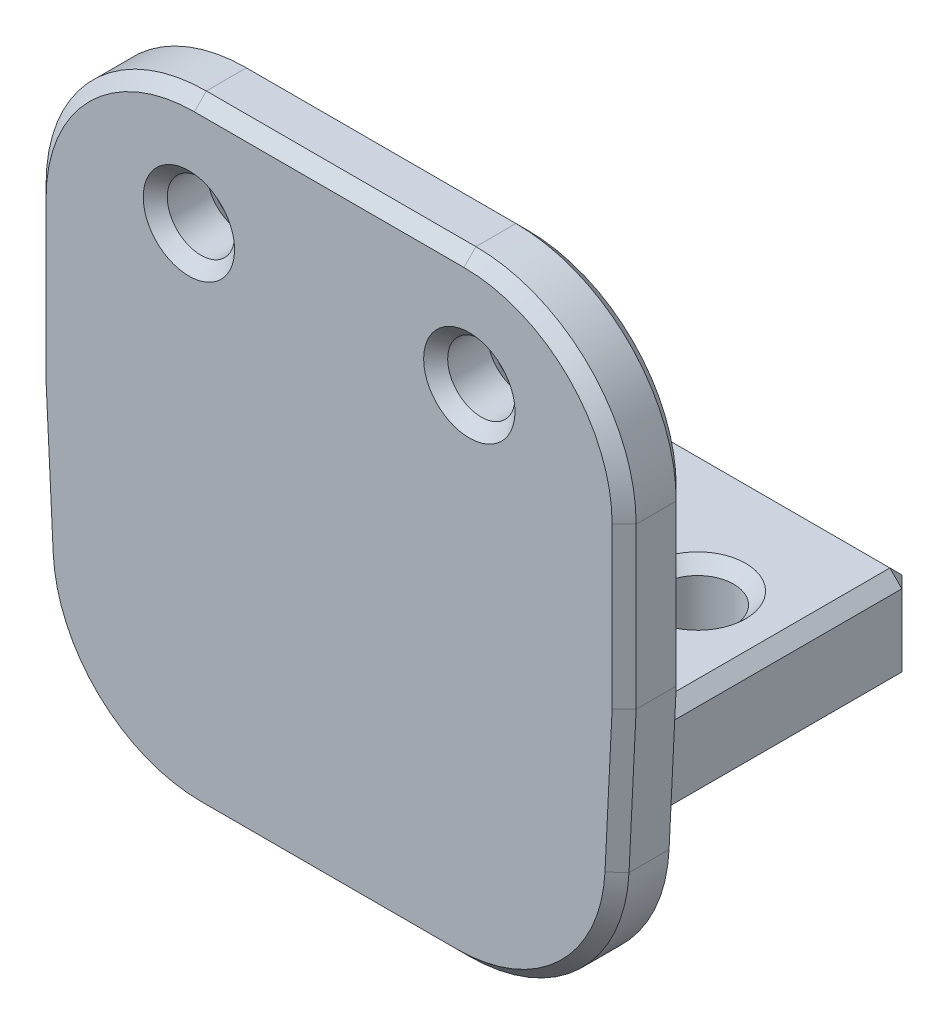
from build123d import *

# Parameters (mm, degrees)
SKETCH1_W           = 25
SKETCH1_H           = 25
BOSS_EXTRUDE1_DEPTH = 6
BOSS_EXTRUDE3_DEPTH = 4
SKETCH2_R           = 2.25
CUT_EXTRUDE1_DEPTH  = 6
SKETCH9_W           = 25
SKETCH9_H           = 6
CUT_EXTRUDE2_DEPTH  = 1
SKETCH11_W          = 36.82832664
SKETCH11_H          = 4
BOSS_EXTRUDE4_DEPTH = 20
SKETCH13_R          = 2.1
CUT_EXTRUDE3_DEPTH  = 50.410927182
FILLET2_R           = 10
CHAMFER1_SIZE       = 0.75
CHAMFER2_SIZE       = 0.75
CHAMFER3_SIZE       = 0.75


with BuildPart() as part:
    # Sketch1 → Boss-Extrude1 (new body)
    with BuildSketch(Plane(origin=(0, 0, 0), x_dir=(1, 0, 0), z_dir=(0, 1, 0))):
        with Locations((12.5, 12.5)):
            Rectangle(SKETCH1_W, SKETCH1_H)
    extrude(amount=BOSS_EXTRUDE1_DEPTH)

    # Sketch5 → Boss-Extrude3 (add)
    with BuildSketch(Plane.XY):
        Polygon((-5.91332664, 12.95), (30.915, 12.95), (30, -5.62), (-5, -5.62), align=None)
    extrude(amount=-BOSS_EXTRUDE3_DEPTH)

    # Sketch2 → Cut-Extrude1 (cut)
    with BuildSketch(Plane.XZ):
        with Locations(Location((5.5, -16, 0), (0, 0, 270))):
            Circle(SKETCH2_R)
        with Locations(Location((19.5, -16, 0), (0, 0, 90))):
            Circle(SKETCH2_R)
    extrude(amount=-CUT_EXTRUDE1_DEPTH, mode=Mode.SUBTRACT)

    # Sketch9 → Cut-Extrude2 (cut)
    with BuildSketch(Plane(origin=(0, 0, -25), x_dir=(-1, 0, 0), z_dir=(0, 0, -1))):
        with Locations((-12.5, 3)):
            Rectangle(SKETCH9_W, SKETCH9_H)
    extrude(amount=-CUT_EXTRUDE2_DEPTH, mode=Mode.SUBTRACT)

    # Sketch11 → Boss-Extrude4 (add)
    with BuildSketch(Plane(origin=(0, 12.95, 0), x_dir=(1, 0, 0), z_dir=(0, 1, 0))):
        with Locations((12.50083668, 2)):
            Rectangle(SKETCH11_W, SKETCH11_H)
    extrude(amount=BOSS_EXTRUDE4_DEPTH)

    # Sketch13 → Cut-Extrude3 (cut, through all)
    with BuildSketch(Plane(origin=(0, 0, -4), x_dir=(-1, 0, 0), z_dir=(0, 0, -1))):
        with Locations((-21.25, 26)):
            Circle(SKETCH13_R)
        with Locations((-3.75, 26)):
            Circle(SKETCH13_R)
    extrude(amount=-CUT_EXTRUDE3_DEPTH, mode=Mode.SUBTRACT)

    # Fillet2
    fillet2_edges = [part.edges().sort_by_distance(p)[0] for p in [
        (30, -5.62, -2),
        (-5, -5.62, -2),
        (-5.91332664, 32.95, -2),
        (30.915, 32.95, -2),
    ]]
    fillet(fillet2_edges, radius=FILLET2_R)

    # Chamfer1
    # the kernel refuses this chamfer: 0.75 mm, written as the material it takes off along each edge
    with BuildSketch(Plane(origin=(20.480598416, -5.62, 0), x_dir=(0, 0.9996219169112968, 0.02749587661058636), z_dir=(-1, 0, 0)), Plane(origin=(20.480598416, -5.62, -4), x_dir=(0, -0.02749587661058678, 0.9996219169112968), z_dir=(-1, 0, 0))) as chamfer1_piece_1:
        Polygon((CHAMFER1_SIZE * 0.999621916911, CHAMFER1_SIZE * 0.0274958766106), (-CHAMFER1_SIZE * 0.0274958766106, CHAMFER1_SIZE * 0.999621916911), (0, 0), align=None)
    extrude(amount=15.960340029, mode=Mode.SUBTRACT)
    with BuildSketch(Plane(origin=(31.009920786, 14.876425142, 0), x_dir=(-0.9984106656617833, 0.04919470969738991, 0.027495876610586206), z_dir=(-0.04921331642006734, -0.9987882906236629, 0)), Plane(origin=(31.009920786, 14.876425142, -4), x_dir=(0.027462559599087527, -0.0013531632758839558, 0.9996219169112968), z_dir=(-0.04921331642006734, -0.9987882906236629, 0))) as chamfer1_piece_2:
        Polygon((CHAMFER1_SIZE * 0.999621916911, CHAMFER1_SIZE * 0.0274958766106), (-CHAMFER1_SIZE * 0.0274958766106, CHAMFER1_SIZE * 0.999621916911), (0, 0), align=None)
    extrude(amount=11.001889398, mode=Mode.SUBTRACT)
    with BuildSketch(Plane(origin=(30.915, 11.021237759, 0), x_dir=(-0.9996219169112968, 0, 0.02749587661058636), z_dir=(0, 1, 0)), Plane(origin=(30.915, 11.021237759, -4), x_dir=(0.02749587661058678, 0, 0.9996219169112968), z_dir=(0, 1, 0))) as chamfer1_piece_3:
        Polygon((CHAMFER1_SIZE * 0.999621916911, -CHAMFER1_SIZE * 0.0274958766106), (-CHAMFER1_SIZE * 0.0274958766106, -CHAMFER1_SIZE * 0.999621916911), (0, 0), align=None)
    extrude(amount=11.928762241, mode=Mode.SUBTRACT)
    with BuildSketch(Plane(origin=(4.08667336, 32.95, 0), x_dir=(0, -0.9996219169112968, 0.027495876610586487), z_dir=(1, 0, 0))) as chamfer1_piece_4:
        Polygon((CHAMFER1_SIZE * 0.999621916911, CHAMFER1_SIZE * 0.0274958766106), (-CHAMFER1_SIZE * 0.0274958766106, CHAMFER1_SIZE * 0.999621916911), (0, 0), align=None)
    extrude(amount=16.82832664, mode=Mode.SUBTRACT)
    with BuildSketch(Plane(origin=(-5.91332664, 11.021237759, 0), x_dir=(0.9996219169112968, 0, 0.02749587661058636), z_dir=(0, 1, 0)), Plane(origin=(-5.91332664, 11.021237759, -4), x_dir=(-0.02749587661058678, 0, 0.9996219169112968), z_dir=(0, 1, 0))) as chamfer1_piece_5:
        Polygon((CHAMFER1_SIZE * 0.999621916911, CHAMFER1_SIZE * 0.0274958766106), (-CHAMFER1_SIZE * 0.0274958766106, CHAMFER1_SIZE * 0.999621916911), (0, 0), align=None)
    extrude(amount=11.928762241, mode=Mode.SUBTRACT)
    with BuildSketch(Plane(origin=(20.915, 22.95, 0), x_dir=(1, 0, 0), z_dir=(0, -1, 0))) as chamfer1_piece_6:
        Polygon((10 - CHAMFER1_SIZE, 0), (10, -CHAMFER1_SIZE), (10, 0), align=None)
    revolve(axis=Axis((20.915, 22.95, 0), (0, 0, 1)), revolution_arc=90, mode=Mode.SUBTRACT)
    with BuildSketch(Plane(origin=(4.08667336, 22.95, 0), x_dir=(0, 1, 0), z_dir=(1, 0, 0))) as chamfer1_piece_7:
        Polygon((10 - CHAMFER1_SIZE, 0), (10, -CHAMFER1_SIZE), (10, 0), align=None)
    revolve(axis=Axis((4.08667336, 22.95, 0), (0, 0, 1)), revolution_arc=90, mode=Mode.SUBTRACT)
    with BuildSketch(Plane(origin=(4.520258387, 4.38, 0), x_dir=(0, -1, 0), z_dir=(1, 0, 0))) as chamfer1_piece_8:
        Polygon((10 - CHAMFER1_SIZE, 0), (10, CHAMFER1_SIZE), (10, 0), align=None)
    revolve(axis=Axis((4.520258387, 4.38, 0), (0, 0, -1)), revolution_arc=87.184295724, mode=Mode.SUBTRACT)
    with BuildSketch(Plane(origin=(20.480598416, 4.38, 0), x_dir=(0.9987882906236628, -0.04921331642006739, 0), z_dir=(0.04921331642006739, 0.9987882906236628, 0))) as chamfer1_piece_9:
        Polygon((10 - CHAMFER1_SIZE, 0), (10, CHAMFER1_SIZE), (10, 0), align=None)
    revolve(axis=Axis((20.480598416, 4.38, 0), (0, 0, -1)), revolution_arc=87.179145229, mode=Mode.SUBTRACT)
    with BuildSketch(Plane(origin=(20.915, 32.95, -4), x_dir=(0, 0.02749587661058218, 0.9996219169112969), z_dir=(-1, 0, 0))) as chamfer1_piece_10:
        Polygon((CHAMFER1_SIZE * 0.999621916911, -CHAMFER1_SIZE * 0.0274958766106), (-CHAMFER1_SIZE * 0.0274958766106, -CHAMFER1_SIZE * 0.999621916911), (0, 0), align=None)
    extrude(amount=16.82832664, mode=Mode.SUBTRACT)
    with BuildSketch(Plane(origin=(20.915, 22.95, -4), x_dir=(1, 0, 0), z_dir=(0, -1, 0))) as chamfer1_piece_11:
        Polygon((10, CHAMFER1_SIZE), (10 - CHAMFER1_SIZE, 0), (10, 0), align=None)
    revolve(axis=Axis((20.915, 22.95, -4), (0, 0, 1)), revolution_arc=90, mode=Mode.SUBTRACT)
    with BuildSketch(Plane(origin=(4.08667336, 22.95, -4), x_dir=(0, 1, 0), z_dir=(1, 0, 0))) as chamfer1_piece_12:
        Polygon((10, CHAMFER1_SIZE), (10 - CHAMFER1_SIZE, 0), (10, 0), align=None)
    revolve(axis=Axis((4.08667336, 22.95, -4), (0, 0, 1)), revolution_arc=90, mode=Mode.SUBTRACT)
    with BuildSketch(Plane(origin=(4.520258387, 4.38, -4), x_dir=(0, -1, 0), z_dir=(1, 0, 0))) as chamfer1_piece_13:
        Polygon((10, -CHAMFER1_SIZE), (10 - CHAMFER1_SIZE, 0), (10, 0), align=None)
    revolve(axis=Axis((4.520258387, 4.38, -4), (0, 0, -1)), revolution_arc=87.184295724, mode=Mode.SUBTRACT)
    with BuildSketch(Plane(origin=(20.480598416, 4.38, -4), x_dir=(0.9987882906236628, -0.04921331642006739, 0), z_dir=(0.04921331642006739, 0.9987882906236628, 0))) as chamfer1_piece_14:
        Polygon((10, -CHAMFER1_SIZE), (10 - CHAMFER1_SIZE, 0), (10, 0), align=None)
    revolve(axis=Axis((20.480598416, 4.38, -4), (0, 0, -1)), revolution_arc=87.179145229, mode=Mode.SUBTRACT)
    with BuildSketch(Plane(origin=(-5.467668718, 3.888764679, 0), x_dir=(0.998415083892051, 0.049104959283599446, 0.027495876610586386), z_dir=(-0.04912353206032882, 0.9987927105250207, 0)), Plane(origin=(-5.467668718, 3.888764679, -4), x_dir=(-0.02746268112814937, -0.0013506945762069992, 0.9996219169112968), z_dir=(-0.04912353206032882, 0.9987927105250207, 0))) as chamfer1_piece_15:
        Polygon((CHAMFER1_SIZE * 0.999621916911, CHAMFER1_SIZE * 0.0274958766106), (-CHAMFER1_SIZE * 0.0274958766106, CHAMFER1_SIZE * 0.999621916911), (0, 0), align=None)
    extrude(amount=11.000950319, mode=Mode.SUBTRACT)
    with BuildSketch(Plane(origin=(21.25, 26, 0), x_dir=(-1, 0, 0), z_dir=(0, -1, 0))) as chamfer1_piece_16:
        Polygon((2.1 + CHAMFER1_SIZE, 0), (2.1, CHAMFER1_SIZE), (2.1, 0), align=None)
    revolve(axis=Axis((21.25, 26, 0), (0, 0, -1)), mode=Mode.SUBTRACT)
    with BuildSketch(Plane(origin=(21.25, 26, -4), x_dir=(-1, 0, 0), z_dir=(0, -1, 0))) as chamfer1_piece_17:
        Polygon((2.1, -CHAMFER1_SIZE), (2.1 + CHAMFER1_SIZE, 0), (2.1, 0), align=None)
    revolve(axis=Axis((21.25, 26, -4), (0, 0, -1)), mode=Mode.SUBTRACT)
    with BuildSketch(Plane(origin=(3.75, 26, 0), x_dir=(-1, 0, 0), z_dir=(0, -1, 0))) as chamfer1_piece_18:
        Polygon((2.1 + CHAMFER1_SIZE, 0), (2.1, CHAMFER1_SIZE), (2.1, 0), align=None)
    revolve(axis=Axis((3.75, 26, 0), (0, 0, -1)), mode=Mode.SUBTRACT)
    with BuildSketch(Plane(origin=(3.75, 26, -4), x_dir=(-1, 0, 0), z_dir=(0, -1, 0))) as chamfer1_piece_19:
        Polygon((2.1, -CHAMFER1_SIZE), (2.1 + CHAMFER1_SIZE, 0), (2.1, 0), align=None)
    revolve(axis=Axis((3.75, 26, -4), (0, 0, -1)), mode=Mode.SUBTRACT)

    # Chamfer2
    chamfer2_edges = [part.edges().sort_by_distance(p)[0] for p in [
        (5.5, 6, -13.75),
        (5.5, 0, -13.75),
        (19.5, 6, -18.25),
        (19.5, 0, -18.25),
    ]]
    chamfer(chamfer2_edges, length=CHAMFER2_SIZE)

    # Chamfer3
    chamfer3_edges = [part.edges().sort_by_distance(p)[0] for p in [
        (25, 0, -14),
        (25, 6, -14),
        (0, 0, -14),
        (0, 6, -14),
        (25, 3, -24),
        (12.5, 6, -24),
        (0, 3, -24),
        (12.5, 0, -24),
    ]]
    chamfer(chamfer3_edges, length=CHAMFER3_SIZE)


solid = part.part
